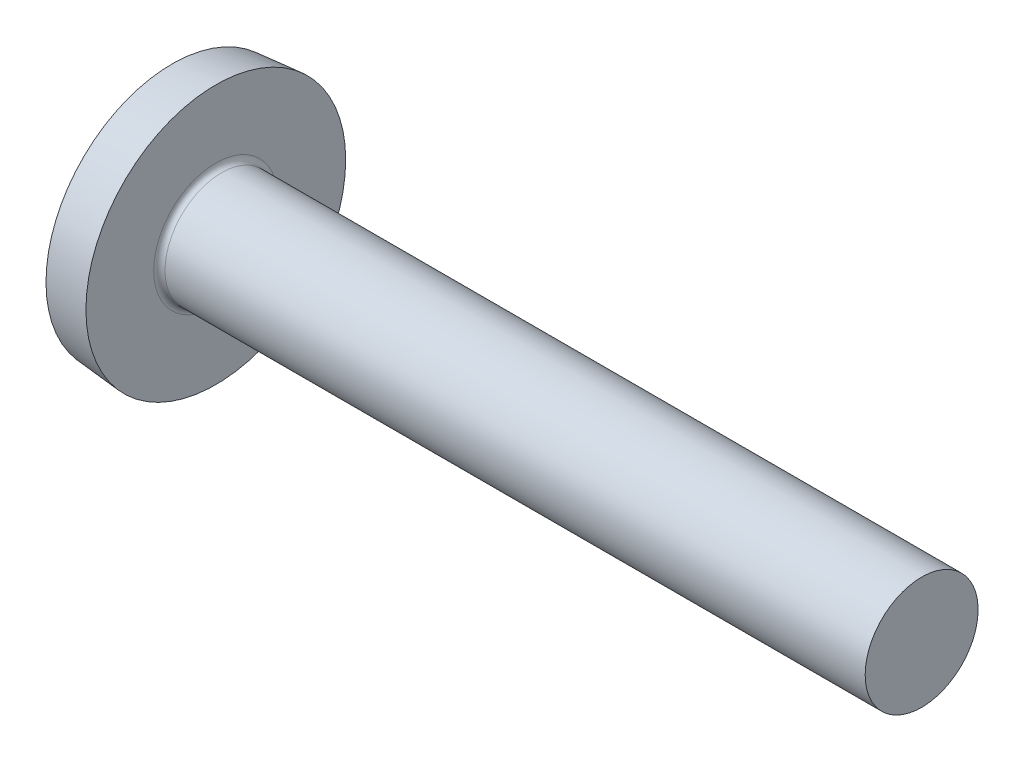
from build123d import *

# Parameters (mm, degrees)
FILLET1_R    = 0.4
RECPAT_COUNT = 2
RECPAT_ANGLE = 90


with BuildPart() as part:
    # BodySke → BaseBody (revolve)
    with BuildSketch(Plane.XY):
        with BuildLine():
            Line((4.8, 4), (4.8, 9.2))
            Line((4.8, 9.2), (1.7, 8.928785143))
            ThreePointArc((1.7, 8.928785143), (0.428783339, 4.544590304), (0, 0))
            Line((0, 0), (54.8, 0))
            Line((54.8, 0), (54.8, 4))
            Line((54.8, 4), (4.8, 4))
        make_face()
    revolve(axis=Axis((0, 0, 0), (1, 0, 0)))

    # Fillet1
    fillet1_edges = [part.edges().sort_by_distance(p)[0] for p in [
        (4.8, -4, 0),
    ]]
    fillet(fillet1_edges, radius=FILLET1_R)

    # RecSkeTop → Recess section 0
    with BuildSketch(Plane(origin=(0, 0, 0), x_dir=(0, 0, -1), z_dir=(1, 0, 0))):
        with BuildLine():
            Line((-0.858, 3.9), (0.858, 3.9))
            Line((0.858, 3.9), (0.858, -3.9))
            Line((0.858, -3.9), (-0.858, -3.9))
            Line((-0.858, -3.9), (-0.858, 3.9))
        make_face()
    # RecSkeBot → Recess section 1
    with BuildSketch(Plane(origin=(4.38, 0, 0), x_dir=(0, 0, -1), z_dir=(1, 0, 0))):
        with BuildLine():
            Line((-0.858, 1.716212922), (0.858, 1.716212922))
            Line((0.858, 1.716212922), (0.858, -1.716212922))
            Line((0.858, -1.716212922), (-0.858, -1.716212922))
            Line((-0.858, -1.716212922), (-0.858, 1.716212922))
        make_face()
    recess = loft(mode=Mode.SUBTRACT)

    # RecPat: Recess ×2 about axis
    recpat_axis = Axis((0, 0, 0), (1, 0, 0))
    for i in range(1, RECPAT_COUNT):
        add(recess.rotate(recpat_axis, i * RECPAT_ANGLE / (RECPAT_COUNT - 1)), mode=Mode.SUBTRACT)

    # RecCorSke → RecessCore (revolve, cut)
    with BuildSketch(Plane.XY):
        Polygon((0, 0), (0, 1.8876), (4.38, 1.581320564), (4.893802197, 0), align=None)
    revolve(axis=Axis((0, 0, 0), (1, 0, 0)), mode=Mode.SUBTRACT)


solid = part.part
